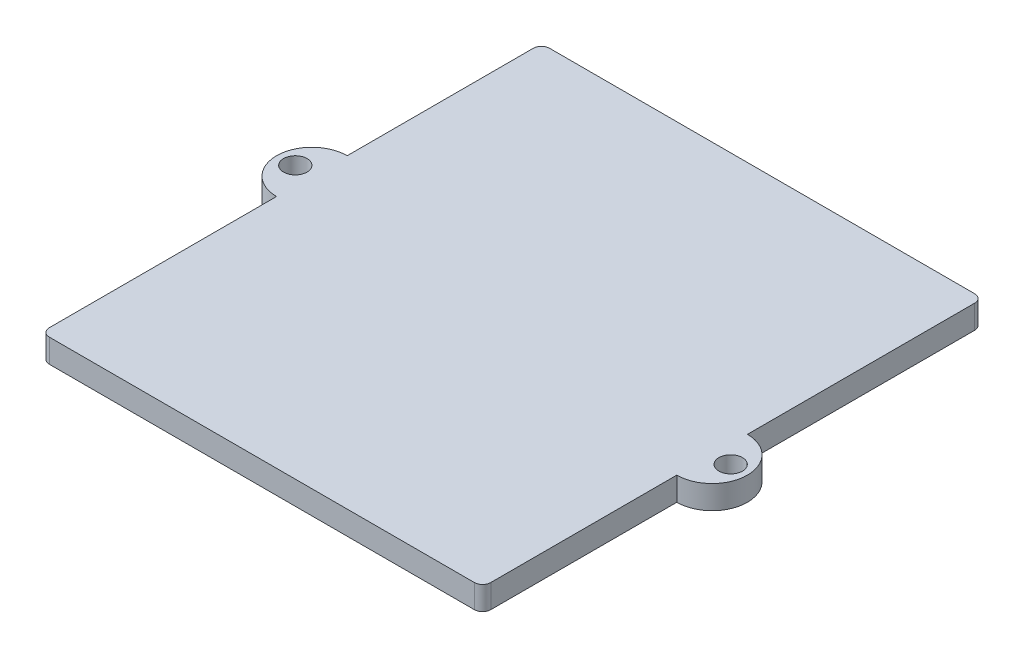
from build123d import *

# Parameters (mm, degrees)
SKETCH1_W           = 95.25
SKETCH1_H           = 107.95
BOSS_EXTRUDE1_DEPTH = 5.08
FILLET1_R           = 1.778
SKETCH2_W           = 7.62
SKETCH2_H           = 5.08
REVOLVE1_ANGLE      = 180
SKETCH3_W           = 7.62
SKETCH3_H           = 5.08
REVOLVE2_ANGLE      = 180
SKETCH4_R           = 2.54
CUT_EXTRUDE1_DEPTH  = 150.202030147
SKETCH5_R           = 2.54
CUT_EXTRUDE2_DEPTH  = 150.202030147


with BuildPart() as part:
    # Sketch1 → Boss-Extrude1 (new body)
    with BuildSketch(Plane(origin=(0, 0, 0), x_dir=(1, 0, 0), z_dir=(0, 1, 0))):
        with Locations((-47.625, -53.975)):
            Rectangle(SKETCH1_W, SKETCH1_H)
    extrude(amount=BOSS_EXTRUDE1_DEPTH)

    # Fillet1
    fillet1_edges = [part.edges().sort_by_distance(p)[0] for p in [
        (-95.25, 2.54, 0),
        (0, 2.54, 107.95),
        (0, 2.54, 0),
        (-95.25, 2.54, 107.95),
    ]]
    fillet(fillet1_edges, radius=FILLET1_R)

    # Sketch2 → Revolve1 (revolve)
    with BuildSketch(Plane.ZY.offset(95.25)):
        with Locations((53.34, 2.54)):
            Rectangle(SKETCH2_W, SKETCH2_H)
    revolve(axis=Axis((-95.25, 5.08, 49.53), (0, -1, 0)), revolution_arc=REVOLVE1_ANGLE)

    # Sketch3 → Revolve2 (revolve)
    with BuildSketch(Plane(origin=(0, 0, 0), x_dir=(0, 0, -1), z_dir=(1, 0, 0))):
        with Locations((-62.23, 2.54)):
            Rectangle(SKETCH3_W, SKETCH3_H)
    revolve(axis=Axis((0, 5.08, 58.42), (0, 1, 0)), revolution_arc=REVOLVE2_ANGLE)

    # Sketch4 → Cut-Extrude1 (cut, through all)
    with BuildSketch(Plane(origin=(0, 5.08, 0), x_dir=(1, 0, 0), z_dir=(0, 1, 0))):
        with Locations((-99.053632383, -49.309816677)):
            Circle(SKETCH4_R)
    extrude(amount=-CUT_EXTRUDE1_DEPTH, mode=Mode.SUBTRACT)

    # Sketch5 → Cut-Extrude2 (cut, through all)
    with BuildSketch(Plane(origin=(0, 5.08, 0), x_dir=(1, 0, 0), z_dir=(0, 1, 0))):
        with Locations((3.804450658, -58.214439329)):
            Circle(SKETCH5_R)
    extrude(amount=-CUT_EXTRUDE2_DEPTH, mode=Mode.SUBTRACT)


solid = part.part
